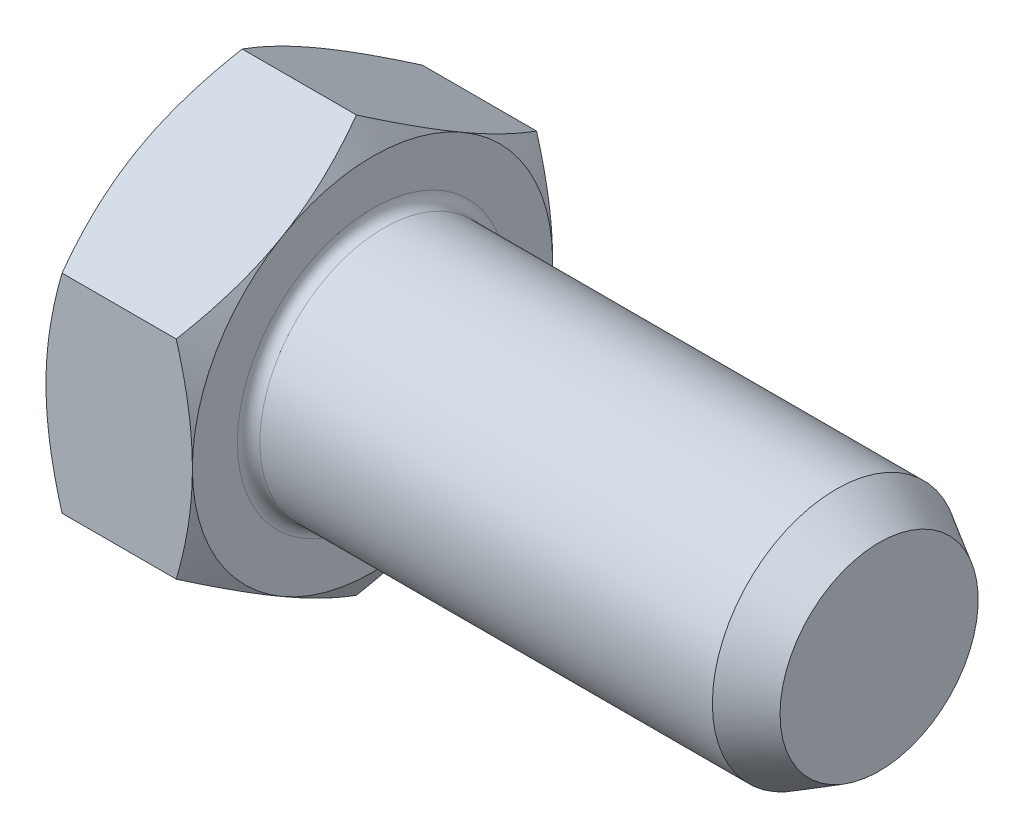
from build123d import *

# Parameters (mm, degrees)
EXTRUDE1_DEPTH = 1.3
SKETCH4_W      = 0.6
SKETCH4_H      = 1.28
CHAMFER1_SIZE  = 0.22
CHAMFER1_SIZE2 = 0.381051178
FILLET1_R      = 0.1


with BuildPart() as part:
    # Sketch1 → Revolve1 (revolve)
    with BuildSketch(Plane.XY):
        Polygon((0, 0), (0, 1.4), (1.3, 1.4), (1.3, 1.1), (5.8, 1.1), (5.8, 0), align=None)
    revolve(axis=Axis((13.107885839, 0, 0), (-1, 0, 0)))

    # Sketch2 → Extrude1 (add)
    with BuildSketch(Plane.ZY):
        Polygon((1.6, -0.923760431), (1.6, 0.923760431), (0, 1.847520861), (-1.6, 0.923760431), (-1.6, -0.923760431), (0, -1.847520861), align=None)
    extrude(amount=-EXTRUDE1_DEPTH)

    # Sketch3 → Cut-Revolve2 (revolve, cut)
    with BuildSketch(Plane(origin=(0, 0, 0), x_dir=(1, 0, 0), z_dir=(0, 1, 0))):
        Polygon((-0.923760431, 0), (0.65, 2.725833025), (1.3, 1.6), (1.3, 3.225833025), (-1.023760431, 3.225833025), (-1.023760431, 0), align=None)
    revolve(axis=Axis((0, 0, 0), (-1, 0, 0)), mode=Mode.SUBTRACT)

    # Sketch4 → Cut-Revolve3 (revolve, cut)
    with BuildSketch(Plane.XY):
        with Locations((0.1, 0.64)):
            Rectangle(SKETCH4_W, SKETCH4_H)
    revolve(axis=Axis((0, 0, 0), (1, 0, 0)), mode=Mode.SUBTRACT)

    # Chamfer1
    chamfer1_edges = [part.edges().sort_by_distance(p)[0] for p in [
        (5.8, -1.1, 0),
    ]]
    chamfer1_side = [part.faces().sort_by_distance(p)[0] for p in [
        (5.8, 0, 0),
    ]]
    chamfer(chamfer1_edges, length=CHAMFER1_SIZE, length2=CHAMFER1_SIZE2, reference=chamfer1_side[0])

    # Fillet1
    fillet1_edges = [part.edges().sort_by_distance(p)[0] for p in [
        (1.3, -1.1, 0),
    ]]
    fillet(fillet1_edges, radius=FILLET1_R)


solid = part.part
